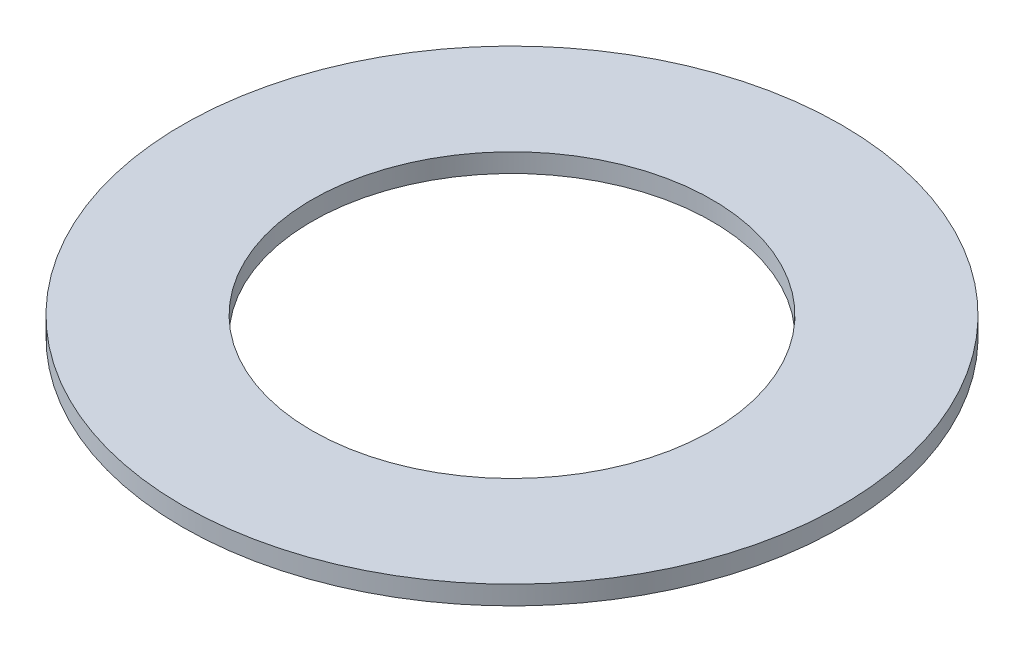
from build123d import *

# Parameters (mm, degrees)
SKETCH1_R           = 70
BOSS_EXTRUDE1_DEPTH = 4
SKETCH2_R           = 42.5
CUT_EXTRUDE1_DEPTH  = 100.075728612


with BuildPart() as part:
    # Sketch1 → Boss-Extrude1 (new body)
    with BuildSketch(Plane(origin=(0, 0, 0), x_dir=(1, 0, 0), z_dir=(0, 1, 0))):
        Circle(SKETCH1_R)
    extrude(amount=BOSS_EXTRUDE1_DEPTH)

    # Sketch2 → Cut-Extrude1 (cut, through all)
    with BuildSketch(Plane(origin=(0, 0, 0), x_dir=(1, 0, 0), z_dir=(0, 1, 0))):
        Circle(SKETCH2_R)
    extrude(amount=CUT_EXTRUDE1_DEPTH, mode=Mode.SUBTRACT)


solid = part.part
